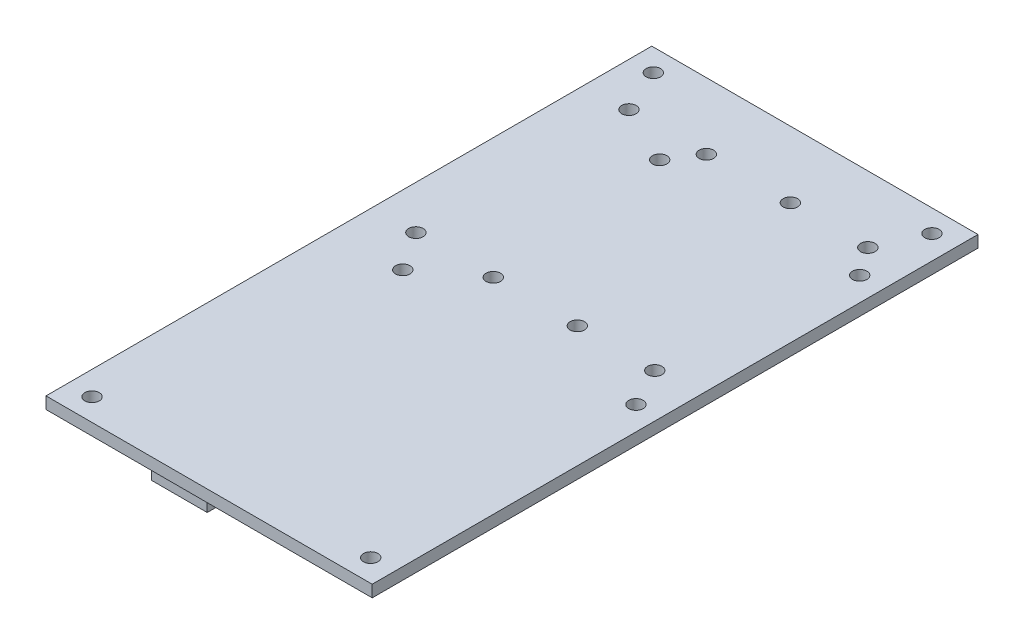
from build123d import *

# Parameters (mm, degrees)
SKETCH1_W                = 70.0024
SKETCH1_H                = 129.9972
BOSS_EXTRUDE1_DEPTH      = 2.54
SKETCH2_R                = 1.5499969
MOUNTING_DEPTH           = 148.668749618
SKETCH3_R                = 1.5499969
STRATOLOGGER_MOUNT_DEPTH = 148.668749618
SKETCH4_R                = 1.5499969
RADIO_MOUNT_DEPTH        = 148.668749618
SKETCH5_W                = 12.0000014
SKETCH5_H                = 14.050000094
BOSS_EXTRUDE2_DEPTH      = 5.999988


with BuildPart() as part:
    # Sketch1 → Boss-Extrude1 (new body)
    with BuildSketch(Plane(origin=(0, 0, 0), x_dir=(1, 0, 0), z_dir=(0, 1, 0))):
        with Locations((35.0012, 64.9986)):
            Rectangle(SKETCH1_W, SKETCH1_H)
    extrude(amount=BOSS_EXTRUDE1_DEPTH)

    # Sketch2 → Mounting (cut, through all)
    with BuildSketch(Plane(origin=(0, 2.54, 0), x_dir=(1, 0, 0), z_dir=(0, 1, 0))):
        with Locations((5.1054, 125.222)):
            Circle(SKETCH2_R)
        with Locations((64.897, 125.222)):
            Circle(SKETCH2_R)
        with Locations((64.897, 4.7752)):
            Circle(SKETCH2_R)
        with Locations((5.1054, 4.7752)):
            Circle(SKETCH2_R)
    extrude(amount=-MOUNTING_DEPTH, mode=Mode.SUBTRACT)

    # Sketch3 → Stratologger Mount (cut, through all)
    with BuildSketch(Plane(origin=(0, 2.54, 0), x_dir=(1, 0, 0), z_dir=(0, 1, 0))):
        with Locations((9.3480001, 115.748199999)):
            Circle(SKETCH3_R)
        with Locations((9.3480001, 70.028199999)):
            Circle(SKETCH3_R)
        with Locations((25.9596001, 70.028199999)):
            Circle(SKETCH3_R)
        with Locations((25.9596001, 115.748199999)):
            Circle(SKETCH3_R)
        with Locations((43.9928, 115.748199999)):
            Circle(SKETCH3_R)
        with Locations((60.6044, 115.748199999)):
            Circle(SKETCH3_R)
        with Locations((60.6044, 70.028199999)):
            Circle(SKETCH3_R)
        with Locations((43.9928, 70.028199999)):
            Circle(SKETCH3_R)
    extrude(amount=-STRATOLOGGER_MOUNT_DEPTH, mode=Mode.SUBTRACT)

    # Sketch4 → Radio Mount (cut, through all)
    with BuildSketch(Plane(origin=(0, 2.54, 0), x_dir=(1, 0, 0), z_dir=(0, 1, 0))):
        with Locations((21.971, 109.712200006)):
            Circle(SKETCH4_R)
        with Locations((64.897, 109.712200006)):
            Circle(SKETCH4_R)
        with Locations((64.897, 61.706200006)):
            Circle(SKETCH4_R)
        with Locations((14.859, 61.706200006)):
            Circle(SKETCH4_R)
    extrude(amount=-RADIO_MOUNT_DEPTH, mode=Mode.SUBTRACT)

    # Sketch5 → Boss-Extrude2 (add)
    with BuildSketch(Plane(origin=(0, 0, 0), x_dir=(-1, 0, 0), z_dir=(0, -1, 0))):
        with Locations((-24.438000705, 11.184999347)):
            Rectangle(SKETCH5_W, SKETCH5_H)
        with Locations((-34.9560007, 120.944200047)):
            Rectangle(SKETCH5_W, SKETCH5_H)
    extrude(amount=BOSS_EXTRUDE2_DEPTH)


solid = part.part
